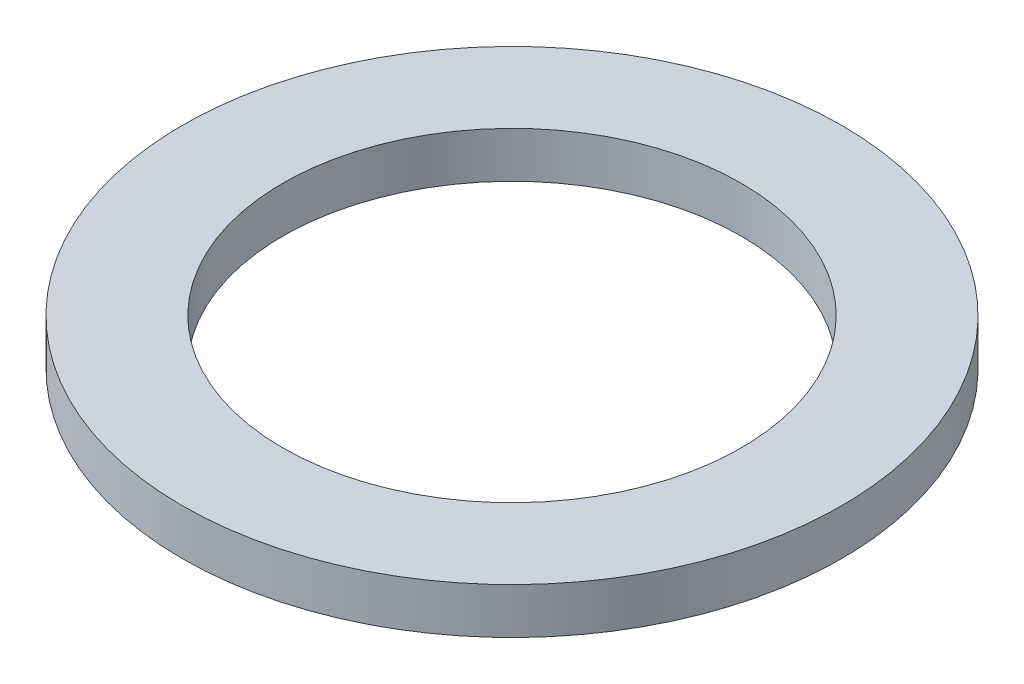
from build123d import *

# Parameters (mm, degrees)
SKETCH1_R           = 57.5
BOSS_EXTRUDE1_DEPTH = 8
SKETCH2_R           = 40
CUT_EXTRUDE1_DEPTH  = 82.709852527


with BuildPart() as part:
    # Sketch1 → Boss-Extrude1 (new body)
    with BuildSketch(Plane(origin=(0, 0, 0), x_dir=(1, 0, 0), z_dir=(0, 1, 0))):
        Circle(SKETCH1_R)
    extrude(amount=BOSS_EXTRUDE1_DEPTH)

    # Sketch2 → Cut-Extrude1 (cut, through all)
    with BuildSketch(Plane(origin=(0, 0, 0), x_dir=(1, 0, 0), z_dir=(0, 1, 0))):
        Circle(SKETCH2_R)
    extrude(amount=CUT_EXTRUDE1_DEPTH, mode=Mode.SUBTRACT)


solid = part.part
